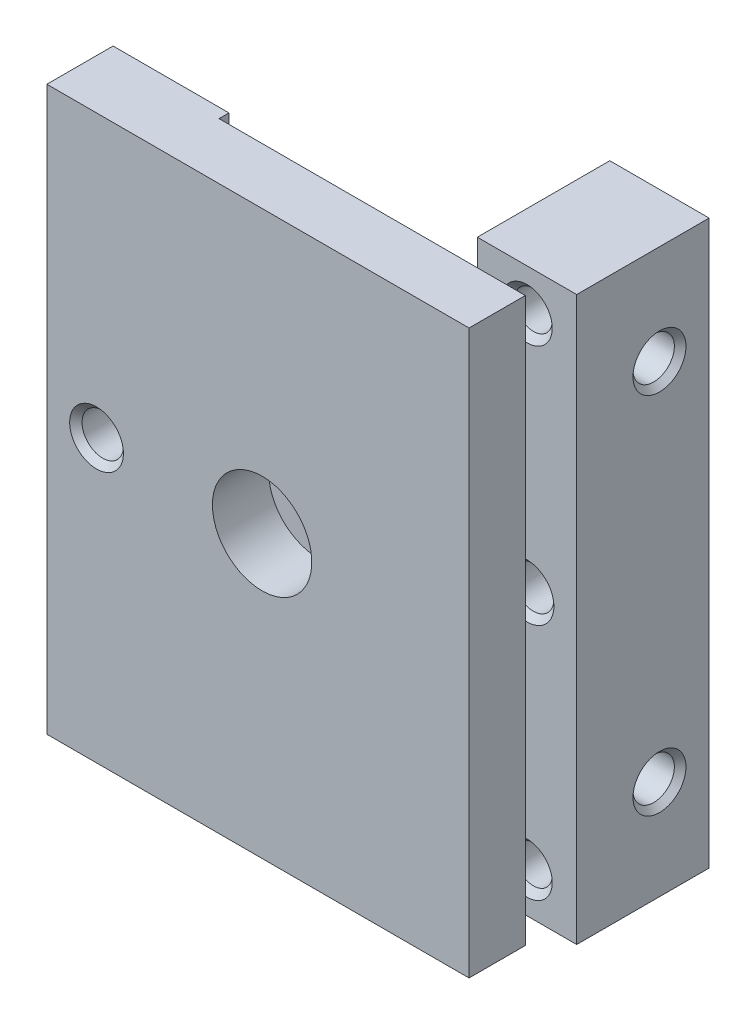
from build123d import *

# Parameters (mm, degrees)
SKETCH_1_W                   = 27
SKETCH_1_H                   = 34
EXTRUDE_1_DEPTH              = 13
SKETCH_2_W                   = 20
SKETCH_2_H                   = 1.6
CUT_EXTRUDE_1_DEPTH          = 46.321076774
CUT_EXTRUDE_2_DEPTH          = 9
CUT_EXTRUDE_3_REACH          = 47.321
SKETCH_4_W                   = 1.5
SKETCH_4_H                   = 34
SKETCH_12_W                  = 21
SKETCH_12_H                  = 34
CUT_EXTRUDE_7_DEPTH          = 6
SKETCH_8_R                   = 3
CUT_EXTRUDE_4_DEPTH          = 46.321076774
HOLE_WIZARD_M31_AT_2_COUNT   = 2
HOLE_WIZARD_M31_AT_2_PITCH   = 22
HOLE_WIZARD_4_401_AT_2_COUNT = 2
HOLE_WIZARD_4_401_AT_2_PITCH = 29


# Read off the part's stored shape, not the designer's step: Отверстие обработанное метчиком M3x0.52
with BuildPart() as part:
    # Эскиз1 → Вытянуть1 (new body)
    with BuildSketch(Plane.XY):
        with Locations((13.5, 17)):
            Rectangle(SKETCH_1_W, SKETCH_1_H)
    extrude(amount=EXTRUDE_1_DEPTH)

    # Эскиз2 → Вырез-Вытянуть1 (cut, through all)
    with BuildSketch(Plane(origin=(0, 34, 0), x_dir=(1, 0, 0), z_dir=(0, 1, 0))):
        with Locations((17, -8.8)):
            Rectangle(SKETCH_2_W, SKETCH_2_H)
    extrude(amount=-CUT_EXTRUDE_1_DEPTH, mode=Mode.SUBTRACT)

    # Эскиз3 → Вырез-Вытянуть2 (cut)
    with BuildSketch(Plane(origin=(0, 0, 0), x_dir=(-1, 0, 0), z_dir=(0, 0, -1))):
        with BuildLine():
            Line((0, 34), (-21, 34))
            Line((-21, 34), (-21, 25))
            ThreePointArc((-21, 25), (-20.414213562, 23.585786438), (-19, 23))
            Line((-19, 23), (-17, 23))
            ThreePointArc((-17, 23), (-15.585786438, 23.585786438), (-15, 25))
            Line((-15, 25), (-15, 28.5))
            Line((-15, 28.5), (0, 28.5))
            Line((0, 28.5), (0, 34))
        make_face()
        with BuildLine():
            Line((0, 0), (0, 5.5))
            Line((0, 5.5), (-15, 5.5))
            Line((-15, 5.5), (-15, 9))
            ThreePointArc((-15, 9), (-15.585786438, 10.414213562), (-17, 11))
            Line((-17, 11), (-19, 11))
            ThreePointArc((-19, 11), (-20.414213562, 10.414213562), (-21, 9))
            Line((-21, 9), (-21, 0))
            Line((-21, 0), (0, 0))
        make_face()
    extrude(amount=-CUT_EXTRUDE_2_DEPTH, mode=Mode.SUBTRACT)

    # Эскиз4 → Вырез-Вытянуть3 (cut, up to next)
    with BuildSketch(Plane.XY.offset(13), mode=Mode.PRIVATE) as cut_extrude_3_sk1:
        with Locations((26.25, 17)):
            Rectangle(SKETCH_4_W, SKETCH_4_H)
    cut_extrude_3_tool1 = extrude(cut_extrude_3_sk1.sketch, amount=-CUT_EXTRUDE_3_REACH, mode=Mode.PRIVATE) & part.part
    add(cut_extrude_3_tool1.solids().sort_by_distance((26.25, 17, 13))[0], mode=Mode.SUBTRACT)

    # Эскиз12 → Вырез-Вытянуть7 (cut)
    with BuildSketch(Plane(origin=(0, 0, 0), x_dir=(-1, 0, 0), z_dir=(0, 0, -1))):
        with Locations((-10.5, 17)):
            Rectangle(SKETCH_12_W, SKETCH_12_H)
    extrude(amount=-CUT_EXTRUDE_7_DEPTH, mode=Mode.SUBTRACT)

    # Эскиз8 → Вырез-Вытянуть4 (cut, through all)
    with BuildSketch(Plane(origin=(0, 0, 0), x_dir=(-1, 0, 0), z_dir=(0, 0, -1))):
        with Locations((-13, 17)):
            Circle(SKETCH_8_R)
    extrude(amount=-CUT_EXTRUDE_4_DEPTH, mode=Mode.SUBTRACT)

    # Эскиз19 → Отверстие обработанное метчиком M31 (revolve, cut)
    with BuildSketch(Plane(origin=(27, 28, 3), x_dir=(0, 0, -1), z_dir=(0, 1, 0))):
        Polygon((0, 0), (0, 6), (1.6, 6), (1.25, 5.65), (1.25, 0.35), (1.6, 0), align=None)
    hole_wizard_m31 = revolve(axis=Axis((33.35, 28, 3), (-1, 0, 0)), mode=Mode.SUBTRACT)

    # Отверстие обработанное метчиком M31 at 2: Отверстие обработанное метчиком M31 ×2
    with Locations(*[(0, -i * HOLE_WIZARD_M31_AT_2_PITCH, 0) for i in range(1, HOLE_WIZARD_M31_AT_2_COUNT)]):
        add(hole_wizard_m31, mode=Mode.SUBTRACT)

    # Отверстие обработанное метчиком M3x0.52 outline → Отверстие обработанное метчиком M3x0.52 (revolve, cut)
    with BuildSketch(Plane(origin=(24, 17, 0), x_dir=(1, 0, 0), z_dir=(0, -1, 0))):
        Polygon((1.625, 8), (0, 8), (0, 0), (1.625, 0), (1.25, 0.375), (1.25, 7.625), align=None)
    revolve(axis=Axis((24, 17, 0), (0, 0, 1)), mode=Mode.SUBTRACT)

    # M3x0.52 2 outline → M3x0.52 2 (revolve, cut)
    with BuildSketch(Plane(origin=(3, 17, 0), x_dir=(1, 0, 0), z_dir=(0, -1, 0))):
        Polygon((1.625, 13), (0, 13), (0, 6), (1.625, 6), (1.25, 6.375), (1.25, 12.625), align=None)
    revolve(axis=Axis((3, 17, 0), (0, 0, 1)), mode=Mode.SUBTRACT)

    # Эскиз24 → Отверстие обработанное метчиком #4-401 (revolve, cut)
    with BuildSketch(Plane(origin=(24, 2.5, 0), x_dir=(0, 1, 0), z_dir=(1, 0, 0))):
        Polygon((0, 0), (0, 8), (1.524, 8), (1.1303, 7.6063), (1.1303, 0.3937), (1.524, 0), align=None)
    hole_wizard_4_401 = revolve(axis=Axis((24, 2.5, -6.35), (0, 0, 1)), mode=Mode.SUBTRACT)

    # Отверстие обработанное метчиком #4-401 at 2: Отверстие обработанное метчиком #4-401 ×2
    with Locations(*[(0, i * HOLE_WIZARD_4_401_AT_2_PITCH, 0) for i in range(1, HOLE_WIZARD_4_401_AT_2_COUNT)]):
        add(hole_wizard_4_401, mode=Mode.SUBTRACT)


solid = part.part
